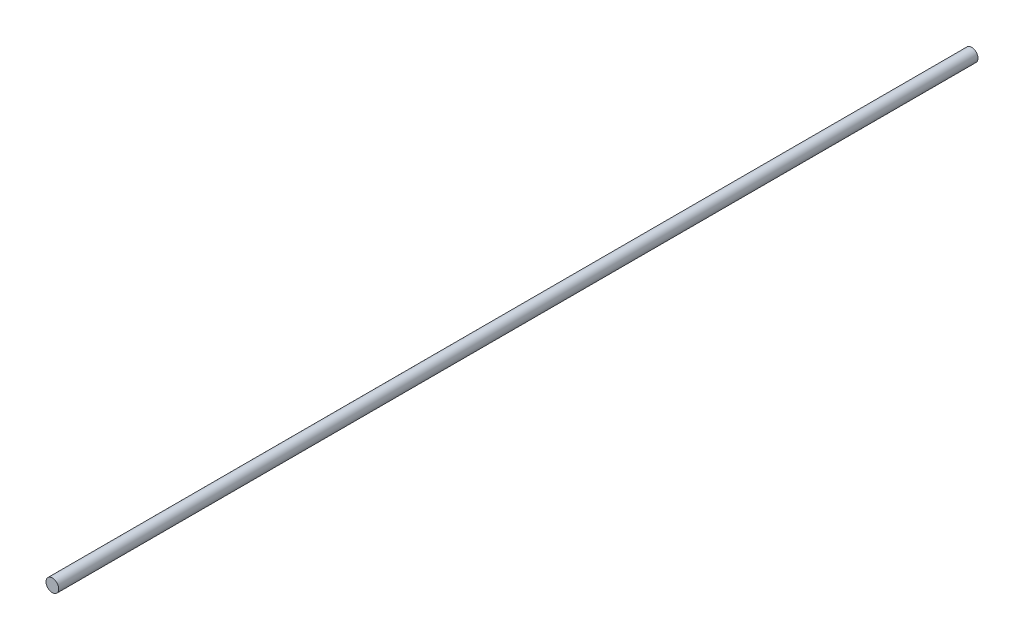
from build123d import *

# Parameters (mm, degrees)
SKETCH1_R           = 6.35
BOSS_EXTRUDE1_DEPTH = 457.2


with BuildPart() as part:
    # Sketch1 → Boss-Extrude1 (new, symmetric)
    with BuildSketch(Plane.XY):
        Circle(SKETCH1_R)
    extrude(amount=BOSS_EXTRUDE1_DEPTH, both=True)


solid = part.part
